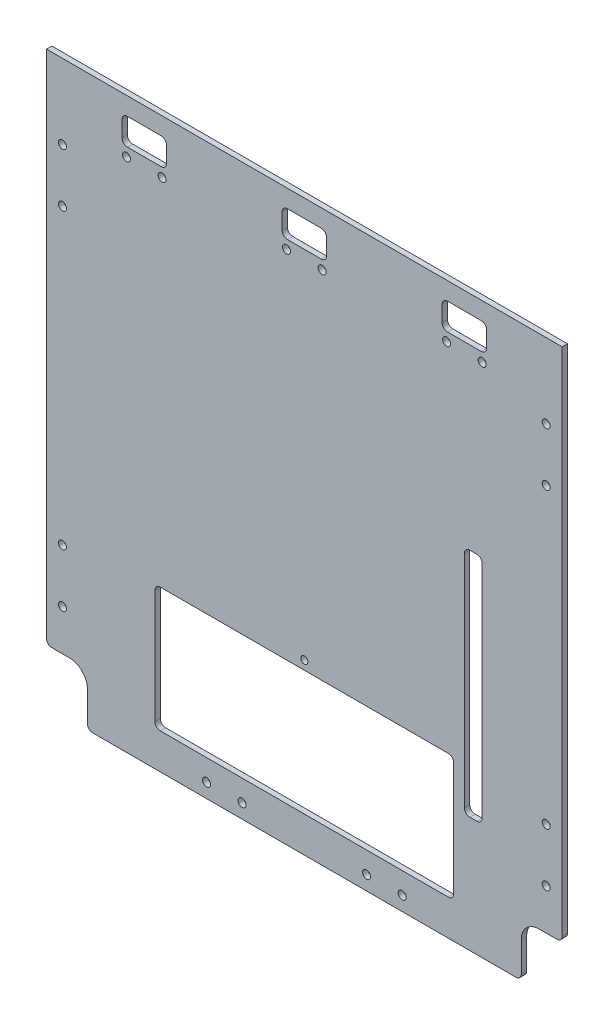
from build123d import *

# Parameters (mm, degrees)
ESQUISSE1_W                  = 290
ESQUISSE1_H                  = 320
BOSS_EXTRU_1_DEPTH           = 3
ENL_V_MAT_EXTRU_1_DEPTH      = 432.866877637
ENL_V_MAT_EXTRU_1_DEPTH_BACK = 432.866877637
ESQUISSE2_W                  = 23
ESQUISSE2_H                  = 30
CONG_1_R                     = 10
CONG_2_R                     = 3
ENL_V_MAT_EXTRU_2_DEPTH      = 432.866877637
ENL_V_MAT_EXTRU_2_DEPTH_BACK = 432.866877637
ESQUISSE3_W                  = 10
ESQUISSE3_H                  = 130
ENL_V_MAT_EXTRU_3_DEPTH      = 432.866877637
ENL_V_MAT_EXTRU_3_DEPTH_BACK = 432.866877637
ESQUISSE4_W                  = 168
ESQUISSE4_H                  = 70
CONG_3_R                     = 3
ENL_V_MAT_EXTRU_4_DEPTH      = 432.866877637
ENL_V_MAT_EXTRU_4_DEPTH_BACK = 432.866877637
ESQUISSE5_R                  = 2
ESQUISSE5_R_2                = 2.25
ENL_V_MAT_EXTRU_5_DEPTH      = 432.866877637
ENL_V_MAT_EXTRU_5_DEPTH_BACK = 432.866877637
ESQUISSE6_R                  = 2.25
ENL_V_MAT_EXTRU_6_DEPTH      = 432.866877637
ENL_V_MAT_EXTRU_6_DEPTH_BACK = 432.866877637
ESQUISSE7_W                  = 25
ESQUISSE7_H                  = 15
CONG_4_R                     = 3


with BuildPart() as part:
    # Esquisse1 → Boss.-Extru.1 (new body)
    with BuildSketch(Plane.XY):
        with Locations((145, 160)):
            Rectangle(ESQUISSE1_W, ESQUISSE1_H)
    extrude(amount=BOSS_EXTRU_1_DEPTH)

    # Esquisse2 → Enlèv. mat.-Extru.1 (cut, two sides: drawn at the far end of the back side and taken through both)
    with BuildSketch(Plane.XY.offset(3).offset(-ENL_V_MAT_EXTRU_1_DEPTH_BACK)):
        with Locations((278.5, 15)):
            Rectangle(ESQUISSE2_W, ESQUISSE2_H)
        with Locations((11.5, 15)):
            Rectangle(ESQUISSE2_W, ESQUISSE2_H)
    extrude(amount=ENL_V_MAT_EXTRU_1_DEPTH + ENL_V_MAT_EXTRU_1_DEPTH_BACK, mode=Mode.SUBTRACT)

    # Congé1
    cong_1_edges = [part.edges().sort_by_distance(p)[0] for p in [
        (23, 30, 1.5),
        (267, 30, 1.5),
    ]]
    fillet(cong_1_edges, radius=CONG_1_R)

    # Congé2
    cong_2_edges = [part.edges().sort_by_distance(p)[0] for p in [
        (267, 0, 1.5),
        (290, 30, 1.5),
        (23, 0, 1.5),
        (0, 30, 1.5),
    ]]
    fillet(cong_2_edges, radius=CONG_2_R)

    # Esquisse3 → Enlèv. mat.-Extru.2 (cut, two sides: drawn at the far end of the back side and taken through both)
    with BuildSketch(Plane.XY.offset(3).offset(-ENL_V_MAT_EXTRU_2_DEPTH_BACK)):
        with Locations((240, 130)):
            Rectangle(ESQUISSE3_W, ESQUISSE3_H)
    extrude(amount=ENL_V_MAT_EXTRU_2_DEPTH + ENL_V_MAT_EXTRU_2_DEPTH_BACK, mode=Mode.SUBTRACT)

    # Esquisse4 → Enlèv. mat.-Extru.3 (cut, two sides: drawn at the far end of the back side and taken through both)
    with BuildSketch(Plane.XY.offset(3).offset(-ENL_V_MAT_EXTRU_3_DEPTH_BACK)):
        with Locations((145, 55)):
            Rectangle(ESQUISSE4_W, ESQUISSE4_H)
    extrude(amount=ENL_V_MAT_EXTRU_3_DEPTH + ENL_V_MAT_EXTRU_3_DEPTH_BACK, mode=Mode.SUBTRACT)

    # Congé3
    cong_3_edges = [part.edges().sort_by_distance(p)[0] for p in [
        (235, 195, 1.5),
        (245, 195, 1.5),
        (245, 65, 1.5),
        (235, 65, 1.5),
        (229, 20, 1.5),
        (229, 90, 1.5),
        (61, 90, 1.5),
        (61, 20, 1.5),
    ]]
    fillet(cong_3_edges, radius=CONG_3_R)

    # Esquisse5 → Enlèv. mat.-Extru.4 (cut, two sides: drawn at the far end of the back side and taken through both)
    with BuildSketch(Plane.XY.offset(3).offset(-ENL_V_MAT_EXTRU_4_DEPTH_BACK)):
        with Locations((145, 95)):
            Circle(ESQUISSE5_R)
        with Locations((90, 8)):
            Circle(ESQUISSE5_R_2)
        with Locations((110, 8)):
            Circle(ESQUISSE5_R_2)
        with Locations((180, 8)):
            Circle(ESQUISSE5_R_2)
        with Locations((200, 8)):
            Circle(ESQUISSE5_R_2)
    extrude(amount=ENL_V_MAT_EXTRU_4_DEPTH + ENL_V_MAT_EXTRU_4_DEPTH_BACK, mode=Mode.SUBTRACT)

    # Esquisse6 → Enlèv. mat.-Extru.5 (cut, two sides: drawn at the far end of the back side and taken through both)
    with BuildSketch(Plane.XY.offset(3).offset(-ENL_V_MAT_EXTRU_5_DEPTH_BACK)):
        with Locations((281, 83)):
            Circle(ESQUISSE6_R)
        with Locations((281, 53)):
            Circle(ESQUISSE6_R)
        with Locations((281, 278)):
            Circle(ESQUISSE6_R)
        with Locations((281, 248)):
            Circle(ESQUISSE6_R)
        with Locations((9, 248)):
            Circle(ESQUISSE6_R)
        with Locations((9, 278)):
            Circle(ESQUISSE6_R)
        with Locations((9, 53)):
            Circle(ESQUISSE6_R)
        with Locations((9, 83)):
            Circle(ESQUISSE6_R)
        with Locations((135, 290)):
            Circle(ESQUISSE6_R)
        with Locations((155, 290)):
            Circle(ESQUISSE6_R)
        with Locations((45, 290)):
            Circle(ESQUISSE6_R)
        with Locations((65, 290)):
            Circle(ESQUISSE6_R)
        with Locations((225, 290)):
            Circle(ESQUISSE6_R)
        with Locations((245, 290)):
            Circle(ESQUISSE6_R)
    extrude(amount=ENL_V_MAT_EXTRU_5_DEPTH + ENL_V_MAT_EXTRU_5_DEPTH_BACK, mode=Mode.SUBTRACT)

    # Esquisse7 → Enlèv. mat.-Extru.6 (cut, two sides: drawn at the far end of the back side and taken through both)
    with BuildSketch(Plane.XY.offset(3).offset(-ENL_V_MAT_EXTRU_6_DEPTH_BACK)):
        with Locations((145, 302.5)):
            Rectangle(ESQUISSE7_W, ESQUISSE7_H)
        with Locations((55, 302.5)):
            Rectangle(ESQUISSE7_W, ESQUISSE7_H)
        with Locations((235, 302.5)):
            Rectangle(ESQUISSE7_W, ESQUISSE7_H)
    extrude(amount=ENL_V_MAT_EXTRU_6_DEPTH + ENL_V_MAT_EXTRU_6_DEPTH_BACK, mode=Mode.SUBTRACT)

    # Congé4
    cong_4_edges = [part.edges().sort_by_distance(p)[0] for p in [
        (222.5, 295, 1.5),
        (247.5, 295, 1.5),
        (247.5, 310, 1.5),
        (222.5, 310, 1.5),
        (132.5, 310, 1.5),
        (157.5, 310, 1.5),
        (132.5, 295, 1.5),
        (157.5, 295, 1.5),
        (67.5, 295, 1.5),
        (67.5, 310, 1.5),
        (42.5, 310, 1.5),
        (42.5, 295, 1.5),
    ]]
    fillet(cong_4_edges, radius=CONG_4_R)


solid = part.part
